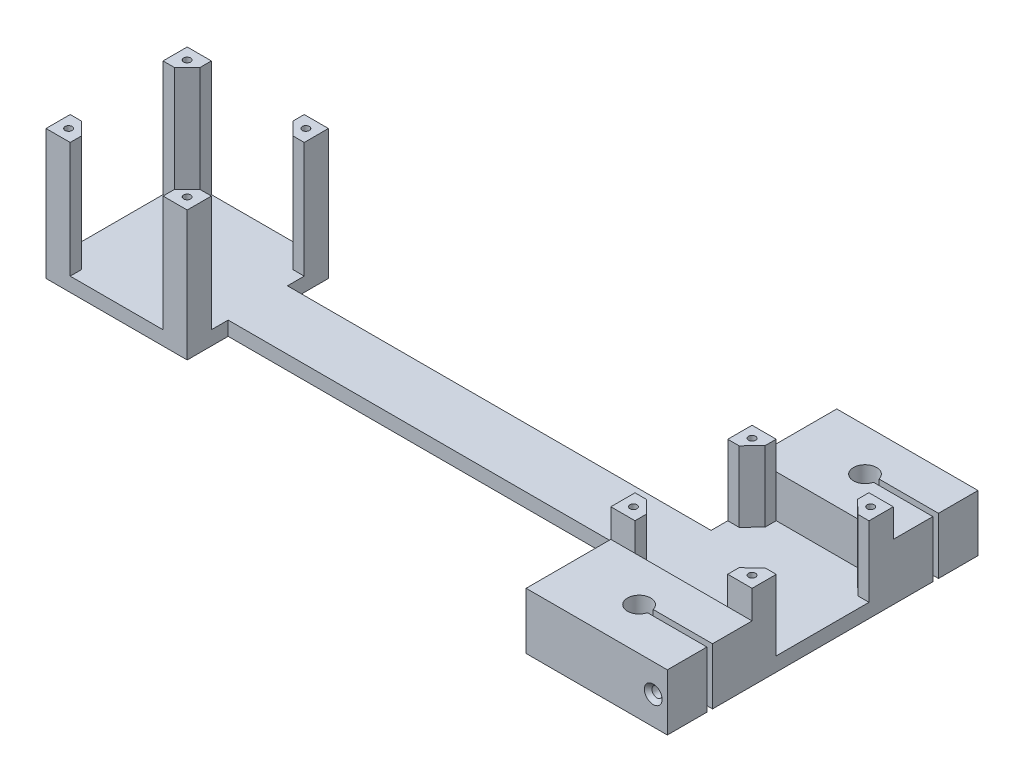
from build123d import *

# Parameters (mm, degrees)
BASE_EXTR_DEPTH                                 = 5
MOTOR_1_EXTR_DEPTH                              = 41
SHAFT_MOTOR_SUPPORT_EXTR_DEPTH                  = 25
TAP_DRILL_FOR_M3X0_5_TAP1_D                     = 2.5
TAP_DRILL_FOR_M3X0_5_TAP1_DEPTH                 = 41
TAP_DRILL_FOR_M3X0_5_TAP1_TIP                   = 0.751075774
BOSS_EXTRUDE10_DEPTH                            = 20
CSK_FOR_M3_OVAL_HEAD_MACHINE_SCREW1_D           = 3.6
CSK_FOR_M3_OVAL_HEAD_MACHINE_SCREW1_DEPTH       = 14
CSK_FOR_M3_OVAL_HEAD_MACHINE_SCREW1_CSINK_D     = 6.3
CSK_FOR_M3_OVAL_HEAD_MACHINE_SCREW1_CSINK_ANGLE = 90
CSK_FOR_M3_OVAL_HEAD_MACHINE_SCREW1_TIP         = 1.081549114
CSK_FOR_M3_OVAL_HEAD_MACHINE_SCREW2_D           = 3.6
CSK_FOR_M3_OVAL_HEAD_MACHINE_SCREW2_DEPTH       = 14
CSK_FOR_M3_OVAL_HEAD_MACHINE_SCREW2_CSINK_D     = 6.3
CSK_FOR_M3_OVAL_HEAD_MACHINE_SCREW2_CSINK_ANGLE = 90
CSK_FOR_M3_OVAL_HEAD_MACHINE_SCREW2_TIP         = 1.081549114


with BuildPart() as part:
    # Base_sch → base_extr (new body)
    with BuildSketch(Plane(origin=(0, 0, 0), x_dir=(1, 0, 0), z_dir=(0, 1, 0))):
        Polygon((25, 10.5), (25, 25), (-25, 25), (-25, -25), (25, -25), (25, -10.5), (175, -10.5), (175, -25), (225.013827764, -25), (225.013827764, 25), (175, 25), (175, 10.5), align=None)
    extrude(amount=BASE_EXTR_DEPTH)

    # motor_support_sch → Motor_1_extr (add)
    with BuildSketch(Plane(origin=(0, 5, 0), x_dir=(1, 0, 0), z_dir=(0, 1, 0))):
        Polygon((-25, 16.439389634), (-25, 25), (-16.439389634, 25), (-16.439389634, 21), (-18.719694817, 18.719694817), (-21, 16.439389634), align=None)
        Polygon((16.439389634, 25), (25, 25), (25, 16.439389634), (21, 16.439389634), (18.719694817, 18.719694817), (16.439389634, 21), align=None)
        Polygon((25, -16.439389634), (25, -25), (16.439389634, -25), (16.439389634, -21), (18.719694817, -18.719694817), (21, -16.439389634), align=None)
        Polygon((-18.719694817, -18.719694817), (-21, -16.439389634), (-25, -16.439389634), (-25, -25), (-16.439389634, -25), (-16.439389634, -21), align=None)
    extrude(amount=MOTOR_1_EXTR_DEPTH)

    # shaft_motor_support_sch → shaft_motor_support_extr (add)
    with BuildSketch(Plane(origin=(0, 5, 0), x_dir=(1, 0, 0), z_dir=(0, 1, 0))):
        Polygon((183.560610366, -21), (179, -16.439389634), (175, -16.439389634), (175, -25), (183.560610366, -25), align=None)
        Polygon((216.38573482, -21), (216.38573482, -25), (225.013827764, -25), (225.013827764, -16.439389634), (221.056642929, -16.439389634), align=None)
        Polygon((183.560610366, 25), (175, 25), (175, 16.402508948), (179, 16.402508948), (183.560610366, 21.024047525), align=None)
        Polygon((225.013827764, 25), (216.38573482, 25), (216.38573482, 21.024047525), (221.056642929, 16.402508948), (225.013827764, 16.402508948), align=None)
    extrude(amount=SHAFT_MOTOR_SUPPORT_EXTR_DEPTH)

    # Tap Drill for M3x0.5 Tap1
    with Locations(Plane(origin=(0, 46, 0), x_dir=(1, 0, 0), z_dir=(0, 1, 0))):
        with Locations((-21, -21), (21, -21), (21, 21), (-21, 21), (179.013827764, 21), (221.013827764, 21), (221.013827764, -21), (179.013827764, -21)):
            Hole(TAP_DRILL_FOR_M3X0_5_TAP1_D / 2, depth=TAP_DRILL_FOR_M3X0_5_TAP1_DEPTH)
            with Locations((0, 0, -(TAP_DRILL_FOR_M3X0_5_TAP1_DEPTH + TAP_DRILL_FOR_M3X0_5_TAP1_TIP / 2))):  # 118° drill point
                Cone(0, TAP_DRILL_FOR_M3X0_5_TAP1_D / 2, TAP_DRILL_FOR_M3X0_5_TAP1_TIP, mode=Mode.SUBTRACT)

    # Sketch12 → Boss-Extrude10 (add)
    with BuildSketch(Plane.XZ):
        with BuildLine():
            Line((175, 25), (175, 55))
            Line((175, 55), (225.013827764, 55))
            Line((225.013827764, 55), (225.013827764, 41))
            Line((225.013827764, 41), (203.983092952, 41))
            ThreePointArc((203.983092952, 41), (195.906913882, 40), (203.983092952, 39))
            Line((203.983092952, 39), (225.013827764, 39))
            Line((225.013827764, 39), (225.013827764, 25))
            Line((225.013827764, 25), (175, 25))
        make_face()
        with BuildLine():
            Line((175, -25), (175, -55))
            Line((175, -55), (225.013827764, -55))
            Line((225.013827764, -55), (225.013827764, -41))
            Line((225.013827764, -41), (203.983092952, -41))
            ThreePointArc((203.983092952, -41), (195.906913882, -40), (203.983092952, -39))
            Line((203.983092952, -39), (225.013827764, -39))
            Line((225.013827764, -39), (225.013827764, -25))
            Line((225.013827764, -25), (175, -25))
        make_face()
    extrude(amount=-BOSS_EXTRUDE10_DEPTH)

    # CSK for M3 Oval Head Machine Screw1
    with Locations(Plane(origin=(220.013827764, 10, 55), x_dir=(1, 0, 0), z_dir=(0, 0, 1))):
        with Locations((0, 0)):
            CounterSinkHole(CSK_FOR_M3_OVAL_HEAD_MACHINE_SCREW1_D / 2, CSK_FOR_M3_OVAL_HEAD_MACHINE_SCREW1_CSINK_D / 2, depth=CSK_FOR_M3_OVAL_HEAD_MACHINE_SCREW1_DEPTH, counter_sink_angle=CSK_FOR_M3_OVAL_HEAD_MACHINE_SCREW1_CSINK_ANGLE)
            with Locations((0, 0, -(CSK_FOR_M3_OVAL_HEAD_MACHINE_SCREW1_DEPTH + CSK_FOR_M3_OVAL_HEAD_MACHINE_SCREW1_TIP / 2))):  # 118° drill point
                Cone(0, CSK_FOR_M3_OVAL_HEAD_MACHINE_SCREW1_D / 2, CSK_FOR_M3_OVAL_HEAD_MACHINE_SCREW1_TIP, mode=Mode.SUBTRACT)

    # CSK for M3 Oval Head Machine Screw2
    with Locations(Plane(origin=(220.013827764, 10, -55), x_dir=(-1, 0, 0), z_dir=(0, 0, -1))):
        with Locations((0, 0)):
            CounterSinkHole(CSK_FOR_M3_OVAL_HEAD_MACHINE_SCREW2_D / 2, CSK_FOR_M3_OVAL_HEAD_MACHINE_SCREW2_CSINK_D / 2, depth=CSK_FOR_M3_OVAL_HEAD_MACHINE_SCREW2_DEPTH, counter_sink_angle=CSK_FOR_M3_OVAL_HEAD_MACHINE_SCREW2_CSINK_ANGLE)
            with Locations((0, 0, -(CSK_FOR_M3_OVAL_HEAD_MACHINE_SCREW2_DEPTH + CSK_FOR_M3_OVAL_HEAD_MACHINE_SCREW2_TIP / 2))):  # 118° drill point
                Cone(0, CSK_FOR_M3_OVAL_HEAD_MACHINE_SCREW2_D / 2, CSK_FOR_M3_OVAL_HEAD_MACHINE_SCREW2_TIP, mode=Mode.SUBTRACT)


solid = part.part
